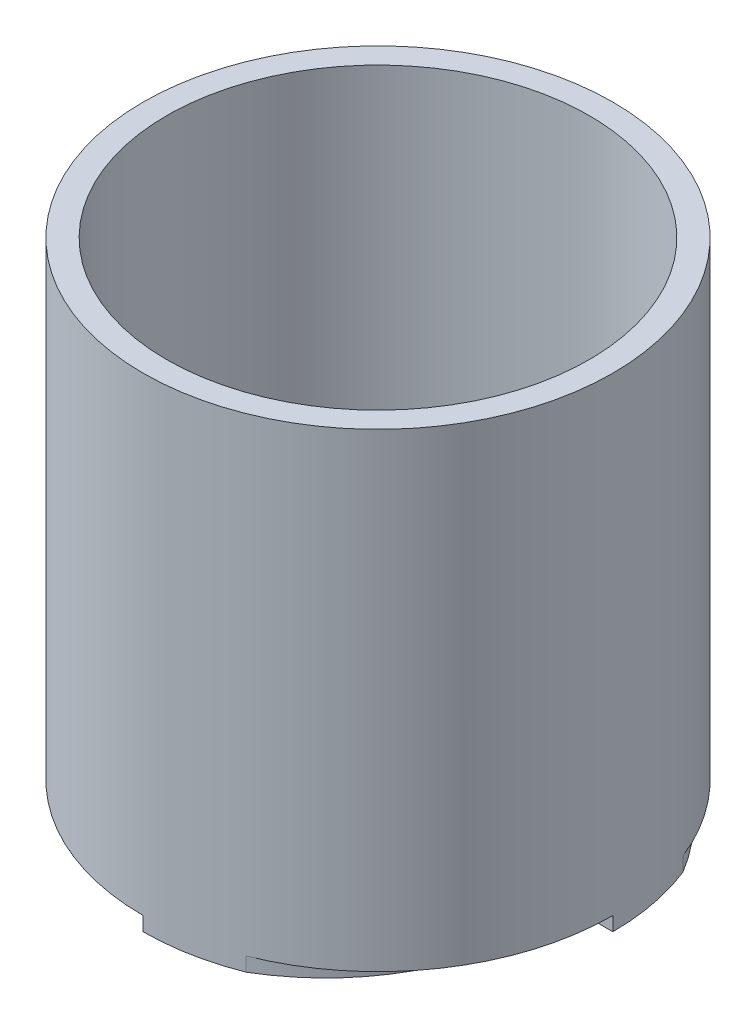
from build123d import *

# Parameters (mm, degrees)
SKETCH1_R           = 50
BOSS_EXTRUDE1_DEPTH = 100
SHELL1_T            = -5
SWEEP1_START        = -3
SWEEP1_DEPTH        = 6
CIRPATTERN1_COUNT   = 4
SKETCH6_R           = 74.0486745
SKETCH6_R_2         = 50
CUT_EXTRUDE1_DEPTH  = 128.385242637


# Read off the part's stored shape, not the designer's step: Sweep1
with BuildPart() as part:
    # Sketch1 → Boss-Extrude1 (new body)
    with BuildSketch(Plane(origin=(0, 0, 0), x_dir=(1, 0, 0), z_dir=(0, 1, 0))):
        with Locations(Location((0, 0, 0), (0, 0, 270))):
            Circle(SKETCH1_R)
    extrude(amount=BOSS_EXTRUDE1_DEPTH)

    # Shell1
    shell1_openings = [part.faces().sort_by_distance(p)[0] for p in [
        (0, 100, 0),
    ]]
    offset(amount=SHELL1_T, openings=shell1_openings, kind=Kind.INTERSECTION)

    # Sweep1 outline → Sweep1 (add)
    with BuildSketch(Plane(origin=(0, 0, 0), x_dir=(1, 0, 0), z_dir=(0, 1, 0)).offset(SWEEP1_START)):
        with BuildLine():
            Line((0, 47), (0, 53))
            add(Edge.make_bspline(
                [(0, 53), (-3.474361712, 52.479162929), (-6.843867063, 51.615920563), (-16.46128233, 48.106692388), (-22.193895733, 44.535618073), (-31.567544344, 35.751110116), (-35.200104056, 30.548397038), (-40.037264934, 19.517206783), (-41.238350772, 13.701748516), (-41.315214766, 2.455365154), (-40.192889087, -2.962363287), (-36.104854824, -12.581556395), (-33.146060235, -16.771758231), (-26.125245082, -23.409434301), (-22.073995949, -25.849369653), (-13.710162327, -28.827227514), (-9.410463433, -29.362552802), (-1.332082703, -28.729722837), (2.433674114, -27.564400311), (8.857565246, -24.012859884), (11.504871432, -21.634611047), (15.388512021, -16.304215444), (16.618073635, -13.364130438), (17.671678142, -7.582628588), (17.494596511, -4.75562703), (16.012609795, 0.2292162), (14.713223104, 2.372731042), (11.45366244, 5.609045319), (9.505363373, 6.690569553), (5.515364449, 7.636727324), (3.489944402, 7.493962766), (-0.006317183, 6.047795585), (-1.447794757, 4.739410807), (-2.659766997, 2.273670196), (-2.900587036, 1.382761278), (-2.962711476, 0.471530176)],
                knots=[0, 0, 0, 0, 0.03125, 0.03125, 0.09375, 0.09375, 0.15625, 0.15625, 0.21875, 0.21875, 0.28125, 0.28125, 0.34375, 0.34375, 0.40625, 0.40625, 0.46875, 0.46875, 0.53125, 0.53125, 0.59375, 0.59375, 0.65625, 0.65625, 0.71875, 0.71875, 0.78125, 0.78125, 0.84375, 0.84375, 0.90625, 0.90625, 0.96875, 0.96875, 1, 1, 1, 1], degree=3))
            Line((-2.962711476, 0.471530176), (2.962711476, -0.471530176))
            add(Edge.make_bspline(
                [(0, 47), (-3.070621674, 46.479171117), (-6.040103102, 45.65626599), (-14.468902175, 42.389656622), (-19.448549587, 39.139153952), (-27.487115071, 31.27798509), (-30.551287574, 26.668579873), (-34.521840512, 17.018293129), (-35.433703195, 11.976159537), (-35.26043133, 2.349589607), (-34.179846377, -2.238556371), (-30.510293771, -10.261757737), (-27.923872137, -13.702409201), (-21.935209161, -19.034991352), (-18.532747186, -20.933380995), (-11.65705971, -23.127038298), (-8.180574243, -23.428300725), (-1.805226336, -22.687859678), (1.099599814, -21.650271539), (5.898878515, -18.721088304), (7.801018104, -16.830481663), (10.445679876, -12.787597846), (11.196036017, -10.632378914), (11.677748051, -6.616315581), (11.415056556, -4.748540265), (10.246909161, -1.698879517), (9.343385104, -0.507102853), (7.39908537, 1.06052808), (6.354889644, 1.44704206), (4.607807918, 1.587230845), (3.896331145, 1.351505839), (3.036983505, 0.696791039), (2.865091683, 0.289041741), (2.865604418, -0.190465468), (2.900622582, -0.341052466), (2.962711476, -0.471530176)],
                knots=[0, 0, 0, 0, 0.03125, 0.03125, 0.09375, 0.09375, 0.15625, 0.15625, 0.21875, 0.21875, 0.28125, 0.28125, 0.34375, 0.34375, 0.40625, 0.40625, 0.46875, 0.46875, 0.53125, 0.53125, 0.59375, 0.59375, 0.65625, 0.65625, 0.71875, 0.71875, 0.78125, 0.78125, 0.84375, 0.84375, 0.90625, 0.90625, 0.96875, 0.96875, 1, 1, 1, 1], degree=3))
        make_face()
    sweep1 = extrude(amount=SWEEP1_DEPTH)

    # CirPattern1: Sweep1 ×4 about axis
    cirpattern1_axis = Axis((0, 100, 0), (0, -1, 0))
    for i in range(1, CIRPATTERN1_COUNT):
        add(sweep1.rotate(cirpattern1_axis, i * 360 / CIRPATTERN1_COUNT))

    # Sketch6 → Cut-Extrude1 (cut, through all)
    with BuildSketch(Plane(origin=(0, 100, 0), x_dir=(1, 0, 0), z_dir=(0, 1, 0))):
        Circle(SKETCH6_R)
        with Locations(Location((0, 0, 0), (0, 0, 270))):
            Circle(SKETCH6_R_2, mode=Mode.SUBTRACT)
    extrude(amount=-CUT_EXTRUDE1_DEPTH, mode=Mode.SUBTRACT)


solid = part.part
